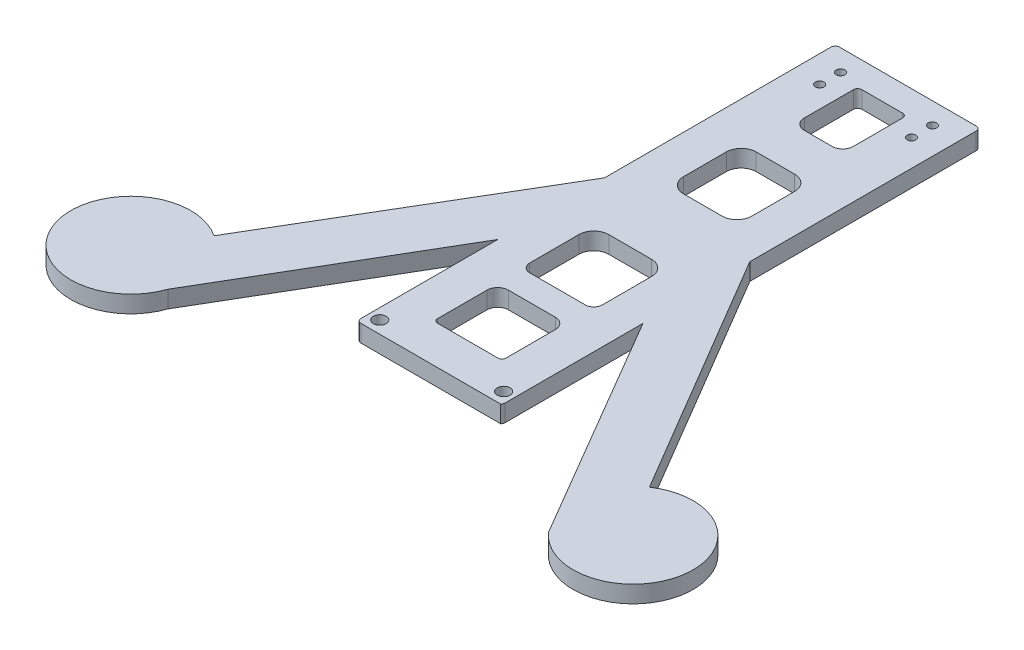
from build123d import *

# Parameters (mm, degrees)
FRAME_SKETCH_R           = 1.5
FRAME_SKETCH_R_2         = 1
FRAME_BOTTOM_PLATE_DEPTH = 4


with BuildPart() as part:
    # Frame Sketch → Frame Bottom Plate (new body)
    with BuildSketch(Plane(origin=(0, 0, 0), x_dir=(1, 0, 0), z_dir=(0, 1, 0))):
        with BuildLine():
            Line((18.280787571, 56.140393786), (-13.719212429, 56.140393786))
            ThreePointArc((-13.719212429, 56.140393786), (-14.42631921, 55.847500567), (-14.719212429, 55.140393786))
            Line((-14.719212429, 55.140393786), (-14.719212429, 2.140393786))
            Line((-14.719212429, 2.140393786), (-48.674660208, -55.289940373))
            ThreePointArc((-48.674660208, -55.289940373), (-69.813458306, -71.412249952), (-43.228375037, -71.517124894))
            Line((-43.228375037, -71.517124894), (-14.719212429, -22.859606214))
            Line((-14.719212429, -22.859606214), (-14.719212429, -54.859606214))
            ThreePointArc((-14.719212429, -54.859606214), (-14.42631921, -55.566712995), (-13.719212429, -55.859606214))
            Line((-13.719212429, -55.859606214), (18.975577815, -55.859606214))
            ThreePointArc((18.975577815, -55.859606214), (19.20132824, -55.531040529), (19.280787571, -55.140393786))
            Line((19.280787571, -55.140393786), (19.280787571, -22.859606214))
            Line((19.280787571, -22.859606214), (50.58641363, -76.289940373))
            ThreePointArc((50.58641363, -76.289940373), (74.99425579, -68.702590503), (53.236235351, -55.289940373))
            Line((53.236235351, -55.289940373), (19.280787571, 2.140393786))
            Line((19.280787571, 2.140393786), (19.280787571, 55.140393786))
            ThreePointArc((19.280787571, 55.140393786), (18.987894353, 55.847500567), (18.280787571, 56.140393786))
        make_face()
        with Locations((-12.219212429, -52.959606214)):
            Circle(FRAME_SKETCH_R, mode=Mode.SUBTRACT)
        with Locations((16.780787571, -52.959606214)):
            Circle(FRAME_SKETCH_R, mode=Mode.SUBTRACT)
        with BuildLine():
            Line((9.421181357, -46.859606214), (-4.859606214, -46.859606214))
            ThreePointArc((-4.859606214, -46.859606214), (-5.467439598, -46.607833383), (-5.719212429, -46))
            Line((-5.719212429, -46), (-5.719212429, -34.359606214))
            ThreePointArc((-5.719212429, -34.359606214), (-4.986979382, -32.591839261), (-3.219212429, -31.859606214))
            Line((-3.219212429, -31.859606214), (7.780787571, -31.859606214))
            ThreePointArc((7.780787571, -31.859606214), (9.548554524, -32.591839261), (10.280787571, -34.359606214))
            Line((10.280787571, -34.359606214), (10.280787571, -46))
            ThreePointArc((10.280787571, -46), (10.02901474, -46.607833383), (9.421181357, -46.859606214))
        make_face(mode=Mode.SUBTRACT)
        with BuildLine():
            ThreePointArc((10.780787571, -23.859606214), (10.195001134, -25.273819777), (8.780787571, -25.859606214))
            Line((8.780787571, -25.859606214), (-4.219212429, -25.859606214))
            ThreePointArc((-4.219212429, -25.859606214), (-5.633425991, -25.273819777), (-6.219212429, -23.859606214))
            Line((-6.219212429, -23.859606214), (-6.219212429, -12.359606214))
            ThreePointArc((-6.219212429, -12.359606214), (-5.194086163, -9.88473248), (-2.719212429, -8.859606214))
            Line((-2.719212429, -8.859606214), (7.280787571, -8.859606214))
            ThreePointArc((7.280787571, -8.859606214), (9.755661306, -9.88473248), (10.780787571, -12.359606214))
            Line((10.780787571, -12.359606214), (10.780787571, -23.859606214))
        make_face(mode=Mode.SUBTRACT)
        with Locations((-8.469212429, 46.240393786)):
            Circle(FRAME_SKETCH_R_2, mode=Mode.SUBTRACT)
        with Locations((-8.469212429, 51.140393786)):
            Circle(FRAME_SKETCH_R_2, mode=Mode.SUBTRACT)
        with BuildLine():
            Line((6.780787571, 8.140393786), (-2.219212429, 8.140393786))
            ThreePointArc((-2.219212429, 8.140393786), (-4.694086163, 9.165520052), (-5.719212429, 11.640393786))
            Line((-5.719212429, 11.640393786), (-5.719212429, 21.640393786))
            ThreePointArc((-5.719212429, 21.640393786), (-4.694086163, 24.11526752), (-2.219212429, 25.140393786))
            Line((-2.219212429, 25.140393786), (6.780787571, 25.140393786))
            ThreePointArc((6.780787571, 25.140393786), (9.255661306, 24.11526752), (10.280787571, 21.640393786))
            Line((10.280787571, 21.640393786), (10.280787571, 11.640393786))
            ThreePointArc((10.280787571, 11.640393786), (9.255661306, 9.165520052), (6.780787571, 8.140393786))
        make_face(mode=Mode.SUBTRACT)
        with BuildLine():
            Line((5.530787571, 35.140393786), (-0.969212429, 35.140393786))
            ThreePointArc((-0.969212429, 35.140393786), (-2.736979382, 35.872626833), (-3.469212429, 37.640393786))
            Line((-3.469212429, 37.640393786), (-3.469212429, 49.140393786))
            ThreePointArc((-3.469212429, 49.140393786), (-3.17631921, 49.847500567), (-2.469212429, 50.140393786))
            Line((-2.469212429, 50.140393786), (7.030787571, 50.140393786))
            ThreePointArc((7.030787571, 50.140393786), (7.737894353, 49.847500567), (8.030787571, 49.140393786))
            Line((8.030787571, 49.140393786), (8.030787571, 37.640393786))
            ThreePointArc((8.030787571, 37.640393786), (7.298554524, 35.872626833), (5.530787571, 35.140393786))
        make_face(mode=Mode.SUBTRACT)
        with Locations((13.030787571, 46.240393786)):
            Circle(FRAME_SKETCH_R_2, mode=Mode.SUBTRACT)
        with Locations((13.030787571, 51.140393786)):
            Circle(FRAME_SKETCH_R_2, mode=Mode.SUBTRACT)
    extrude(amount=FRAME_BOTTOM_PLATE_DEPTH)


solid = part.part
